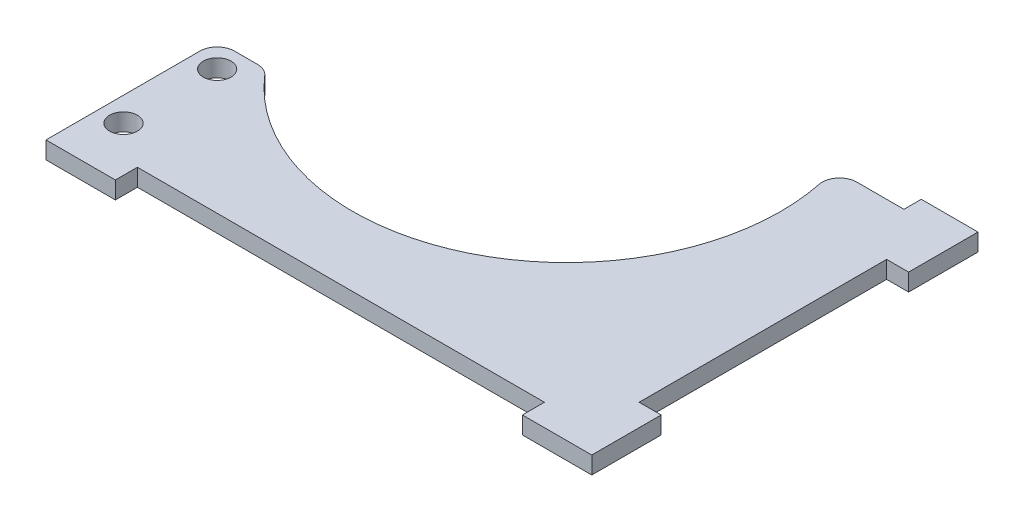
from build123d import *

# Parameters (mm, degrees)
SKETCH1_R           = 4
BOSS_EXTRUDE1_DEPTH = 2.5
FILLET1_R           = 5


with BuildPart() as part:
    # Sketch1 → Boss-Extrude1 (new, symmetric)
    with BuildSketch(Plane(origin=(0, 0, 0), x_dir=(1, 0, 0), z_dir=(0, 1, 0))):
        with BuildLine():
            Line((-78.675, -55.675), (-58.675, -55.675))
            Line((-58.675, -55.675), (-58.675, -49.325))
            Line((-58.675, -49.325), (58.675, -49.325))
            Line((58.675, -49.325), (58.675, -55.675))
            Line((58.675, -55.675), (78.675, -55.675))
            Line((78.675, -55.675), (78.675, -35.675))
            Line((78.675, -35.675), (72.325, -35.675))
            Line((72.325, -35.675), (72.325, 35.675))
            Line((72.325, 35.675), (78.675, 35.675))
            Line((78.675, 35.675), (78.675, 55.675))
            Line((78.675, 55.675), (62.325, 55.675))
            Line((62.325, 55.675), (62.325, 50.675))
            Line((62.325, 50.675), (42.325, 50.675))
            ThreePointArc((42.325, 50.675), (12.399475155, -22.078839327), (-64.675, -6.325))
            Line((-64.675, -6.325), (-78.675, -6.325))
            Line((-78.675, -6.325), (-78.675, -55.675))
        make_face()
        with Locations((-71.675, -40.325)):
            Circle(SKETCH1_R, mode=Mode.SUBTRACT)
        with Locations((-71.675, -13.325)):
            Circle(SKETCH1_R, mode=Mode.SUBTRACT)
    extrude(amount=BOSS_EXTRUDE1_DEPTH, both=True)

    # Fillet1
    fillet1_edges = [part.edges().sort_by_distance(p)[0] for p in [
        (42.325, 0, -50.675),
        (-78.675, 0, 6.325),
        (-64.675, 0, 6.325),
    ]]
    fillet(fillet1_edges, radius=FILLET1_R)


solid = part.part
